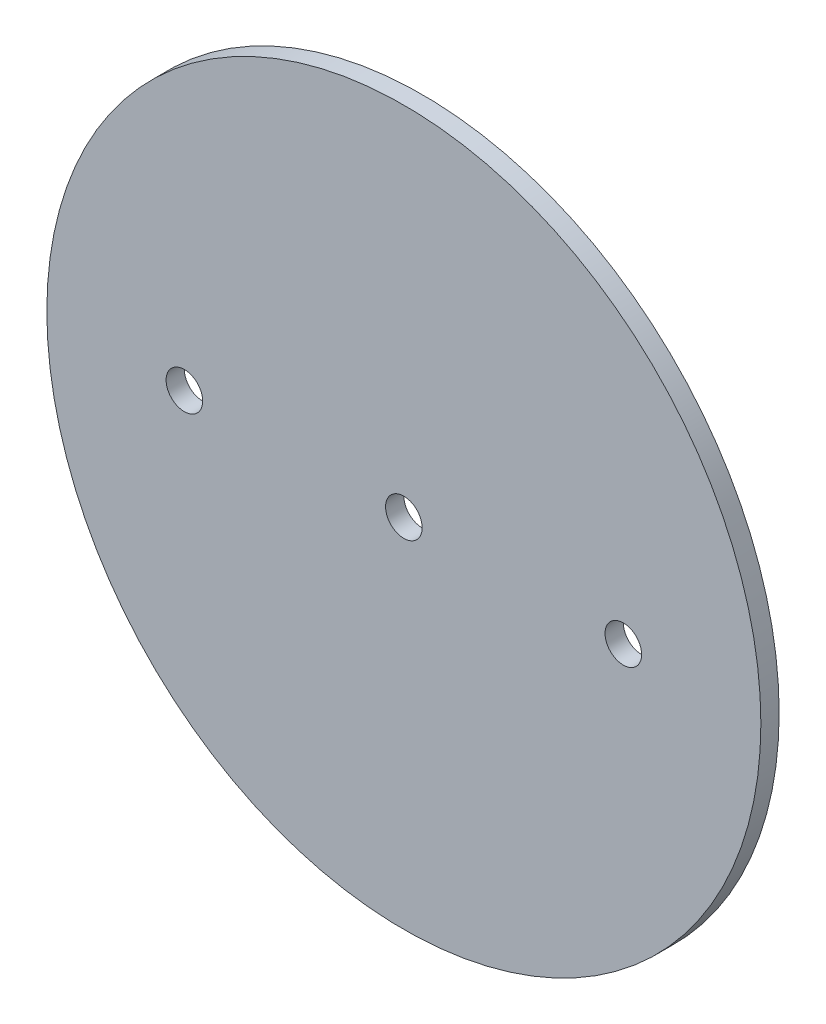
from build123d import *

# Parameters (mm, degrees)
SKETCH1_R                   = 61.976
BOSS_EXTRUDE1_DEPTH         = 1.5875
F_1_4_0_25_DIAMETER_HOLE1_D = 6.35


with BuildPart() as part:
    # Sketch1 → Boss-Extrude1 (new, symmetric)
    with BuildSketch(Plane.XY):
        Circle(SKETCH1_R)
    extrude(amount=BOSS_EXTRUDE1_DEPTH, both=True)

    # 1/4 (0.25) Diameter Hole1 (through all)
    with Locations(Plane.XY.offset(1.5875)):
        with Locations((-38.1, 0), (0, 0), (38.1, 0)):
            Hole(F_1_4_0_25_DIAMETER_HOLE1_D / 2)


solid = part.part
